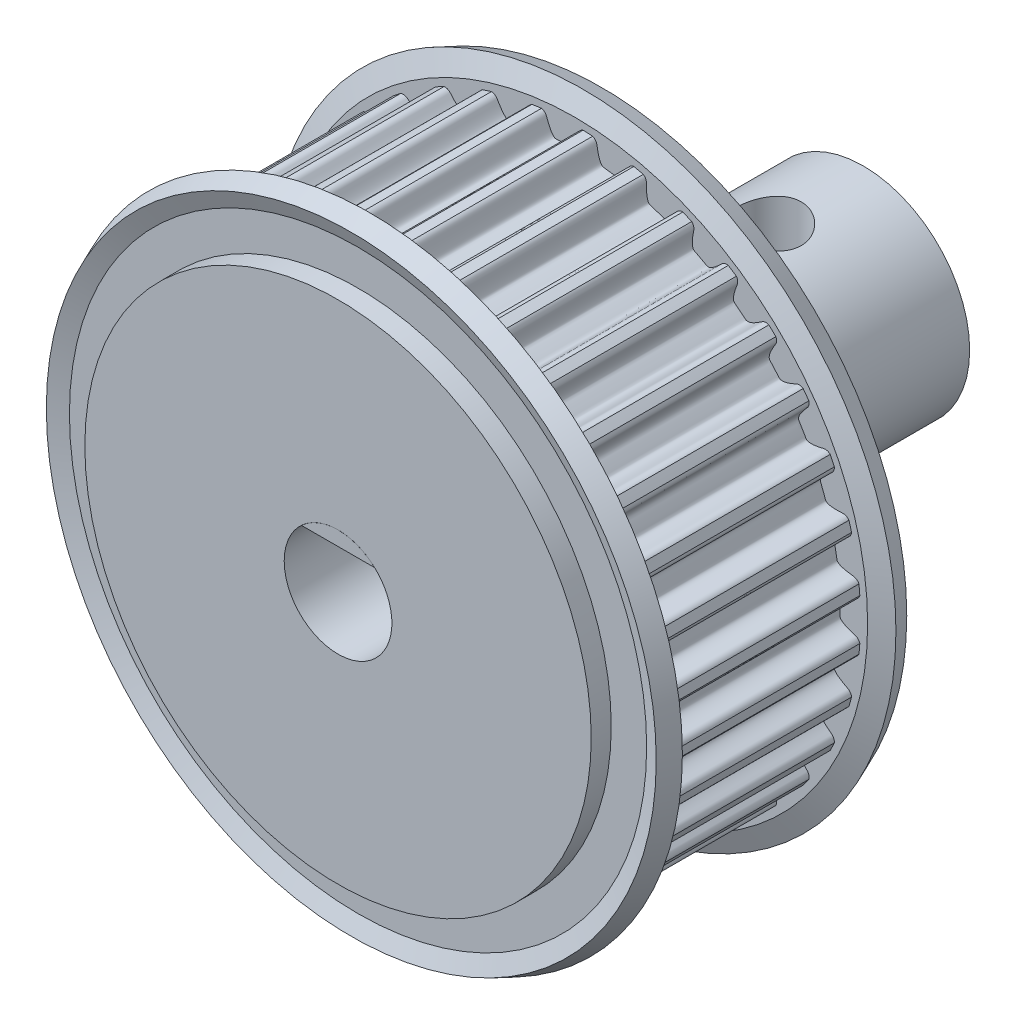
from build123d import *

# Parameters (mm, degrees)
TOOTHEXTRUDECUTGEARBELT01_DEPTH = 3.749999944
TOOTH_PATTERN_35_COUNT          = 35
BOREREVOLVESKETCH_W             = 10.547999842
BOREREVOLVESKETCH_H             = 5
SKETCH_5_R                      = 5
EXTRUDE_1_DEPTH                 = 10
SKETCH_6_R                      = 4.05
SKETCH_6_R_2                    = 2.05
EXTRUDE_2_DEPTH                 = 10
CUT_EXTRUDE_START               = -10
SKETCH_7_R                      = 2.05
CUT_EXTRUDE_2_DEPTH             = 10
EXTRUDE_3_DEPTH                 = 20
SKETCH_9_R                      = 1.25
CUT_EXTRUDE_6_DEPTH             = 24.198471801


with BuildPart() as part:
    # SketchRevolveGearBelt01 → Gates_PowerGrip_GT_2mm, 6mm Belt Width (revolve)
    with BuildSketch(Plane(origin=(0, 0, 0), x_dir=(0, 0, -1), z_dir=(1, 0, 0))):
        Polygon((5.273999921, 0), (5.273999921, 9.640845872), (4.511999932, 9.640845872), (4.511999932, 10.989274627), (4.769626867, 11.611241067), (4.065630673, 11.902845838), (3.749999944, 11.140845849), (3.749999944, 10.872030033), (-3.749999944, 10.872030033), (-3.749999944, 11.140845849), (-4.065630673, 11.902845838), (-4.769626867, 11.611241067), (-4.511999932, 10.989274627), (-4.511999932, 9.640845872), (-5.273999921, 9.640845872), (-5.273999921, 0), align=None)
    revolve(axis=Axis((0, 0, 0), (0, 0, -1)))

    # SketchToothGearBelt01 → ToothExtrudeCutGearBelt01 (cut, symmetric)
    with BuildSketch(Plane.XY):
        with BuildLine():
            ThreePointArc((10.852064234, 0.862058304), (10.886250165, 0), (10.852064234, -0.862058304))
            add(Edge.make_bspline(
                [(10.852064234, -0.862058304), (10.852248096, -0.844642179), (10.849947295, -0.818492719), (10.841842285, -0.784572094), (10.833304572, -0.759848143), (10.822389407, -0.736077867), (10.809201587, -0.713489161), (10.793867489, -0.692298882), (10.776534448, -0.672709417), (10.757367683, -0.654911744), (10.736554766, -0.639064944), (10.71428128, -0.625364292), (10.690813148, -0.613779586), (10.653137038, -0.600389458), (10.604628452, -0.585707101), (10.547010566, -0.567480144), (10.494560937, -0.549825925), (10.445281416, -0.53218684), (10.399177233, -0.514546582), (10.356246021, -0.496909286), (10.316486972, -0.479273964), (10.279898494, -0.461640694), (10.246478674, -0.444008949), (10.216225019, -0.426377751), (10.189134503, -0.408745201), (10.165203298, -0.391107907), (10.144428104, -0.373460068), (10.126804032, -0.355792311), (10.112337539, -0.33809054), (10.101016773, -0.320336691), (10.0929309, -0.302512788), (10.087890137, -0.28461649), (10.085688892, -0.250312541), (10.088871159, -0.199994192), (10.089015214, -0.1333067), (10.089783746, -0.066656855), (10.089897818, 0), (10.089783746, 0.066656855), (10.089015214, 0.1333067), (10.088871159, 0.199994192), (10.085688892, 0.250312541), (10.087890137, 0.28461649), (10.0929309, 0.302512788), (10.101016773, 0.320336691), (10.112337539, 0.33809054), (10.126804032, 0.355792311), (10.144428104, 0.373460068), (10.165203298, 0.391107907), (10.189134503, 0.408745201), (10.216225019, 0.426377751), (10.246478674, 0.444008949), (10.279898494, 0.461640694), (10.316486972, 0.479273964), (10.356246021, 0.496909286), (10.399177233, 0.514546582), (10.445281416, 0.53218684), (10.494560937, 0.549825925), (10.547010566, 0.567480144), (10.604628452, 0.585707101), (10.653137038, 0.600389458), (10.690813148, 0.613779586), (10.71428128, 0.625364292), (10.736554766, 0.639064944), (10.757367683, 0.654911744), (10.776534448, 0.672709417), (10.793867489, 0.692298882), (10.809201587, 0.713489161), (10.822389407, 0.736077867), (10.833304572, 0.759848143), (10.841842285, 0.784572094), (10.849947295, 0.818492719), (10.852248096, 0.844642179), (10.852064234, 0.862058304)],
                knots=[0, 0, 0, 0, 0.020006147, 0.030009221, 0.040012294, 0.050015368, 0.060018441, 0.070021515, 0.080024588, 0.090027662, 0.100030735, 0.110033809, 0.120036882, 0.130039956, 0.15593293, 0.178284408, 0.199478937, 0.219523667, 0.238427048, 0.256199162, 0.272852143, 0.288400748, 0.302863113, 0.316261785, 0.328625135, 0.339989287, 0.350400774, 0.359920108, 0.368626423, 0.376623029, 0.384042937, 0.391052069, 0.397846505, 0.423403792, 0.448935862, 0.474467931, 0.5, 0.525532069, 0.551064138, 0.576596208, 0.602153495, 0.608947931, 0.615957063, 0.623376971, 0.631373577, 0.640079892, 0.649599226, 0.660010713, 0.671374865, 0.683738215, 0.697136887, 0.711599252, 0.727147857, 0.743800838, 0.761572952, 0.780476333, 0.800521063, 0.821715592, 0.84406707, 0.869960044, 0.879963118, 0.889966191, 0.899969265, 0.909972338, 0.919975412, 0.929978485, 0.939981559, 0.949984632, 0.959987706, 0.969990779, 0.979993853, 1, 1, 1, 1], degree=3))
        make_face()
    toothextrudecutgearbelt01 = extrude(amount=TOOTHEXTRUDECUTGEARBELT01_DEPTH, both=True, mode=Mode.SUBTRACT)

    # Tooth Pattern, 35: ToothExtrudeCutGearBelt01 ×35 about axis
    tooth_pattern_35_axis = Axis((0, 0, 55), (0, 0, -1))
    for i in range(1, TOOTH_PATTERN_35_COUNT):
        add(toothextrudecutgearbelt01.rotate(tooth_pattern_35_axis, i * 360 / TOOTH_PATTERN_35_COUNT), mode=Mode.SUBTRACT)

    # BoreRevolveSketch → BoreRevolveCut (revolve, cut)
    with BuildSketch(Plane(origin=(0, 0, 0), x_dir=(0, 0, -1), z_dir=(1, 0, 0))):
        with Locations((0, 2.5)):
            Rectangle(BOREREVOLVESKETCH_W, BOREREVOLVESKETCH_H)
    revolve(axis=Axis((0, 0, 0), (0, 0, -1)), mode=Mode.SUBTRACT)

    # 草图5 → 凸台-拉伸1 (add)
    with BuildSketch(Plane.XY.offset(5.273999921)):
        Circle(SKETCH_5_R)
    extrude(amount=-EXTRUDE_1_DEPTH)

    # 草图6 → 凸台-拉伸2 (add)
    with BuildSketch(Plane(origin=(0, 0, -4.726000079), x_dir=(-1, 0, 0), z_dir=(0, 0, -1))):
        Circle(SKETCH_6_R)
        Circle(SKETCH_6_R_2, mode=Mode.SUBTRACT)
    extrude(amount=EXTRUDE_2_DEPTH)

    # 草图7 → 切除-拉伸2 (cut)
    with BuildSketch(Plane(origin=(0, 0, -4.726000079), x_dir=(-1, 0, 0), z_dir=(0, 0, -1)).offset(CUT_EXTRUDE_START)):
        Circle(SKETCH_7_R)
    extrude(amount=CUT_EXTRUDE_2_DEPTH, mode=Mode.SUBTRACT)


with BuildPart() as body_2:
    # 草图8 → 凸台-拉伸3 (new body)
    with BuildSketch(Plane(origin=(0, 0, -14.726000079), x_dir=(-1, 0, 0), z_dir=(0, 0, -1))):
        with BuildLine():
            ThreePointArc((1.393142236, 1.5), (0, 2.047155414), (-1.393142236, 1.5))
            Line((-1.393142236, 1.5), (0, 1.5))
            Line((0, 1.5), (1.393142236, 1.5))
        make_face()
    extrude(amount=-EXTRUDE_3_DEPTH)


with BuildPart() as cut_extrude_6_tool:
    # 草图9 → 切除-拉伸6 (new, through all)
    with BuildSketch(Plane.XZ.offset(-1.5)):
        with Locations((0, -11.1094353)):
            Circle(SKETCH_9_R)
    extrude(amount=-CUT_EXTRUDE_6_DEPTH)


with BuildPart() as part_1:
    add(part.part)

    # 切除-拉伸6: cut by cut_extrude_6_tool
    add(cut_extrude_6_tool.part, mode=Mode.SUBTRACT)


with BuildPart() as body_2_1:
    add(body_2.part)

    # 切除-拉伸6: cut by cut_extrude_6_tool
    add(cut_extrude_6_tool.part, mode=Mode.SUBTRACT)


solid = Compound([part_1.part, body_2_1.part])
